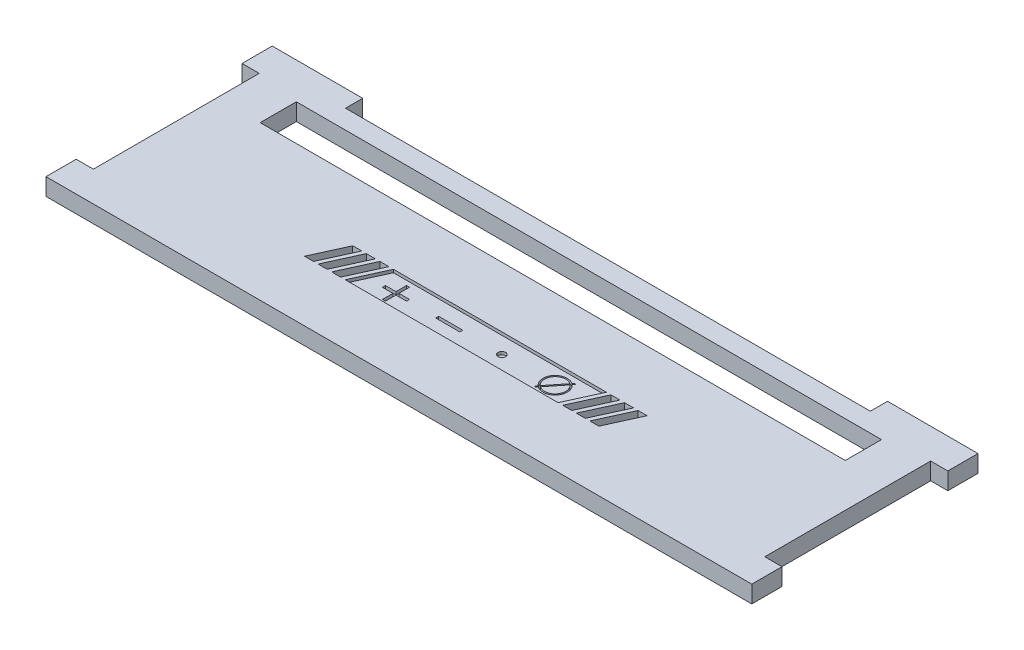
from build123d import *

# Parameters (mm, degrees)
SKETCH1_W           = 234
SKETCH1_H           = 75
BOSS_EXTRUDE1_DEPTH = 5.7
SKETCH2_W           = 5.7
SKETCH2_H           = 55
CUT_EXTRUDE1_DEPTH  = 5.7
SKETCH3_W           = 194
SKETCH3_H           = 12
CUT_EXTRUDE2_DEPTH  = 5.7
SKETCH4_W           = 174
SKETCH4_H           = 5.7
CUT_EXTRUDE3_DEPTH  = 5.7
CUT_EXTRUDE4_REACH  = 247.792
CUT_EXTRUDE5_DEPTH  = 1
SKETCH5_9_W         = 8
SKETCH5_9_H         = 1
SKETCH5_9_R         = 1.25
CUT_EXTRUDE7_DEPTH  = 2


with BuildPart() as part:
    # Sketch1 → Boss-Extrude1 (new body)
    with BuildSketch(Plane(origin=(0, 0, 0), x_dir=(1, 0, 0), z_dir=(0, 1, 0))):
        with Locations((117, 37.5)):
            Rectangle(SKETCH1_W, SKETCH1_H)
    extrude(amount=BOSS_EXTRUDE1_DEPTH)

    # Sketch2 → Cut-Extrude1 (cut)
    with BuildSketch(Plane(origin=(0, 5.7, 0), x_dir=(1, 0, 0), z_dir=(0, 1, 0))):
        with Locations((2.85, 37.5)):
            Rectangle(SKETCH2_W, SKETCH2_H)
        with Locations((231.15, 37.5)):
            Rectangle(SKETCH2_W, SKETCH2_H)
    extrude(amount=-CUT_EXTRUDE1_DEPTH, mode=Mode.SUBTRACT)

    # Sketch3 → Cut-Extrude2 (cut)
    with BuildSketch(Plane(origin=(0, 5.7, 0), x_dir=(1, 0, 0), z_dir=(0, 1, 0))):
        with Locations((117, 57)):
            Rectangle(SKETCH3_W, SKETCH3_H)
    extrude(amount=-CUT_EXTRUDE2_DEPTH, mode=Mode.SUBTRACT)

    # Sketch4 → Cut-Extrude3 (cut)
    with BuildSketch(Plane(origin=(0, 5.7, 0), x_dir=(1, 0, 0), z_dir=(0, 1, 0))):
        with Locations((117, 72.15)):
            Rectangle(SKETCH4_W, SKETCH4_H)
    extrude(amount=-CUT_EXTRUDE3_DEPTH, mode=Mode.SUBTRACT)

    # Sketch5 → Cut-Extrude4 (cut, up to next)
    with BuildSketch(Plane(origin=(0, 5.7, 0), x_dir=(1, 0, 0), z_dir=(0, 1, 0)), mode=Mode.PRIVATE) as cut_extrude4_sk1:
        Polygon((73.7, 31), (70.7, 31), (65.7, 20), (68.7, 20), align=None)
    cut_extrude4_tool1 = extrude(cut_extrude4_sk1.sketch, amount=-CUT_EXTRUDE4_REACH, mode=Mode.PRIVATE) & part.part
    # Sketch5 → Cut-Extrude4 (cut, up to next)
    with BuildSketch(Plane(origin=(0, 5.7, 0), x_dir=(1, 0, 0), z_dir=(0, 1, 0)), mode=Mode.PRIVATE) as cut_extrude4_sk2:
        Polygon((78.2, 31), (75.2, 31), (70.2, 20), (73.2, 20), align=None)
    cut_extrude4_tool2 = extrude(cut_extrude4_sk2.sketch, amount=-CUT_EXTRUDE4_REACH, mode=Mode.PRIVATE) & part.part
    # Sketch5 → Cut-Extrude4 (cut, up to next)
    with BuildSketch(Plane(origin=(0, 5.7, 0), x_dir=(1, 0, 0), z_dir=(0, 1, 0)), mode=Mode.PRIVATE) as cut_extrude4_sk3:
        Polygon((82.7, 31), (79.7, 31), (74.7, 20), (77.7, 20), align=None)
    cut_extrude4_tool3 = extrude(cut_extrude4_sk3.sketch, amount=-CUT_EXTRUDE4_REACH, mode=Mode.PRIVATE) & part.part
    # Sketch5 → Cut-Extrude4 (cut, up to next)
    with BuildSketch(Plane(origin=(0, 5.7, 0), x_dir=(1, 0, 0), z_dir=(0, 1, 0)), mode=Mode.PRIVATE) as cut_extrude4_sk4:
        Polygon((159.3, 31), (156.3, 31), (151.3, 20), (154.3, 20), align=None)
    cut_extrude4_tool4 = extrude(cut_extrude4_sk4.sketch, amount=-CUT_EXTRUDE4_REACH, mode=Mode.PRIVATE) & part.part
    # Sketch5 → Cut-Extrude4 (cut, up to next)
    with BuildSketch(Plane(origin=(0, 5.7, 0), x_dir=(1, 0, 0), z_dir=(0, 1, 0)), mode=Mode.PRIVATE) as cut_extrude4_sk5:
        Polygon((163.8, 31), (160.8, 31), (155.8, 20), (158.8, 20), align=None)
    cut_extrude4_tool5 = extrude(cut_extrude4_sk5.sketch, amount=-CUT_EXTRUDE4_REACH, mode=Mode.PRIVATE) & part.part
    # Sketch5 → Cut-Extrude4 (cut, up to next)
    with BuildSketch(Plane(origin=(0, 5.7, 0), x_dir=(1, 0, 0), z_dir=(0, 1, 0)), mode=Mode.PRIVATE) as cut_extrude4_sk6:
        Polygon((168.3, 31), (165.3, 31), (160.3, 20), (163.3, 20), align=None)
    cut_extrude4_tool6 = extrude(cut_extrude4_sk6.sketch, amount=-CUT_EXTRUDE4_REACH, mode=Mode.PRIVATE) & part.part
    add(cut_extrude4_tool1.solids().sort_by_distance((69.7, 5.7, -25.5))[0], mode=Mode.SUBTRACT)
    add(cut_extrude4_tool2.solids().sort_by_distance((74.2, 5.7, -25.5))[0], mode=Mode.SUBTRACT)
    add(cut_extrude4_tool3.solids().sort_by_distance((78.7, 5.7, -25.5))[0], mode=Mode.SUBTRACT)
    add(cut_extrude4_tool4.solids().sort_by_distance((155.3, 5.7, -25.5))[0], mode=Mode.SUBTRACT)
    add(cut_extrude4_tool5.solids().sort_by_distance((159.8, 5.7, -25.5))[0], mode=Mode.SUBTRACT)
    add(cut_extrude4_tool6.solids().sort_by_distance((164.3, 5.7, -25.5))[0], mode=Mode.SUBTRACT)

    # Sketch5<6> → Cut-Extrude5 (cut)
    with BuildSketch(Plane(origin=(0, 5.7, 0), x_dir=(1, 0, 0), z_dir=(0, 1, 0))):
        Polygon((84.2, 31), (79.2, 20), (149.8, 20), (154.8, 31), align=None)
    extrude(amount=-CUT_EXTRUDE5_DEPTH, mode=Mode.SUBTRACT)

    # Sketch5<9> → Cut-Extrude7 (cut)
    # profile 1 of 4: a face of its own
    with BuildSketch(Plane(origin=(0, 5.7, 0), x_dir=(1, 0, 0), z_dir=(0, 1, 0))):
        with BuildLine():
            Line((145.990268597, 28.460144401), (146.463906187, 29.051717562))
            Line((146.463906187, 29.051717562), (146.073593813, 29.364217562))
            Line((146.073593813, 29.364217562), (145.599956222, 28.772644401))
            ThreePointArc((145.599956222, 28.772644401), (140.177501001, 28), (140.609731403, 22.539855599))
            Line((140.609731403, 22.539855599), (140.136093813, 21.948282438))
            Line((140.136093813, 21.948282438), (140.526406187, 21.635782438))
            Line((140.526406187, 21.635782438), (141.000043778, 22.227355599))
            ThreePointArc((141.000043778, 22.227355599), (146.422498999, 23), (145.990268597, 28.460144401))
        make_face()
        with BuildLine():
            Line((141.313243681, 22.618542152), (145.677068694, 28.068957848))
            ThreePointArc((145.677068694, 28.068957848), (146.032186624, 23.3125), (141.313243681, 22.618542152))
        make_face(mode=Mode.SUBTRACT)
        with BuildLine():
            Line((145.286756319, 28.381457848), (140.922931306, 22.931042152))
            ThreePointArc((140.922931306, 22.931042152), (140.567813376, 27.6875), (145.286756319, 28.381457848))
        make_face(mode=Mode.SUBTRACT)
    # profile 2 of 4: a face of its own
    with BuildSketch(Plane(origin=(0, 5.7, 0), x_dir=(1, 0, 0), z_dir=(0, 1, 0))):
        Polygon((86.525, 25), (90.025, 25), (90.025, 21.5), (91.025, 21.5), (91.025, 25), (94.525, 25), (94.525, 26), (91.025, 26), (91.025, 29.5), (90.025, 29.5), (90.025, 26), (86.525, 26), align=None)
    # profile 3 of 4: a face of its own
    with BuildSketch(Plane(origin=(0, 5.7, 0), x_dir=(1, 0, 0), z_dir=(0, 1, 0))):
        with Locations((108.175, 25.5)):
            Rectangle(SKETCH5_9_W, SKETCH5_9_H)
    # profile 4 of 4: a face of its own
    with BuildSketch(Plane(origin=(0, 5.7, 0), x_dir=(1, 0, 0), z_dir=(0, 1, 0))):
        with Locations((125.65, 25.5)):
            Circle(SKETCH5_9_R)
    extrude(amount=-CUT_EXTRUDE7_DEPTH, mode=Mode.SUBTRACT)


solid = part.part
